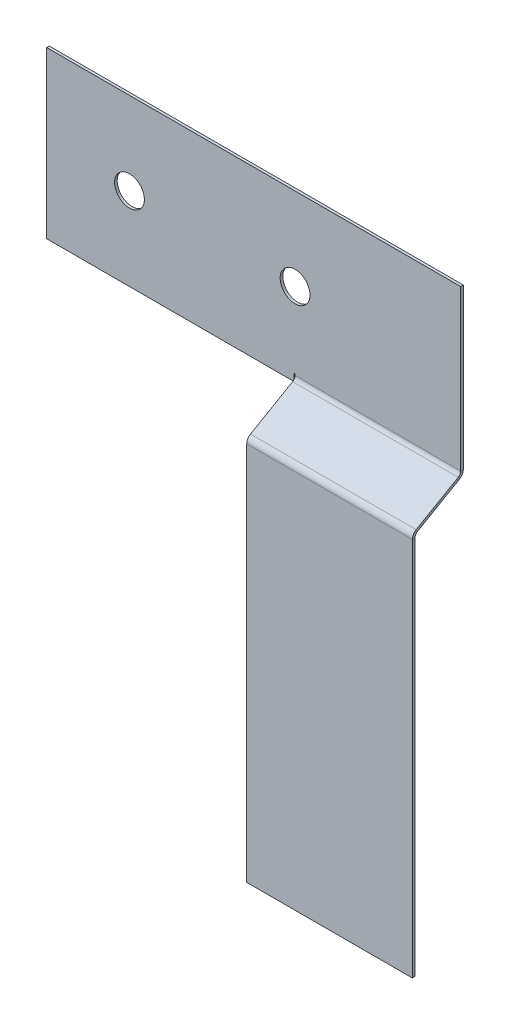
from build123d import *

# Parameters (mm, degrees)
SKETCH1_W            = 62.5
SKETCH1_H            = 25
SKETCH1_R            = 2.25
BASE_FLANGE1_DEPTH   = 0.4
EDGE_FLANGE1_START   = 37.3
EDGE_FLANGE1_DEPTH   = 25.2
EDGE_FLANGE1_2_DEPTH = 0.2
EDGE_FLANGE1_START_2 = 37.5
EDGE_FLANGE1_3_DEPTH = 25
EDGE_FLANGE2_DEPTH   = 25


# Read off the part's stored shape, not the designer's step: Edge-Flange1
# Sheet-metal steps are written as plain solids
with BuildPart() as part:
    # Sketch1 → Base-Flange1 (new body)
    with BuildSketch(Plane.XY):
        with Locations((31.25, 12.5)):
            Rectangle(SKETCH1_W, SKETCH1_H)
        with Locations((12.5, 12.5)):
            Circle(SKETCH1_R, mode=Mode.SUBTRACT)
        with Locations((37.5, 12.5)):
            Circle(SKETCH1_R, mode=Mode.SUBTRACT)
    extrude(amount=-BASE_FLANGE1_DEPTH)

    # Edge-Flange1 outline → Edge-Flange1 (cut)
    with BuildSketch(Plane.YZ.offset(EDGE_FLANGE1_START)):
        with BuildLine():
            Line((0, -0.4), (0.887156424, -0.4))
            ThreePointArc((0.887156424, -0.4), (0.410375552, -0.295165264), (0.021546812, 0))
            Line((0.021546812, 0), (0, 0))
            Line((0, 0), (0, -0.4))
        make_face()
    extrude(amount=EDGE_FLANGE1_DEPTH, mode=Mode.SUBTRACT)

    # Edge-Flange1 2 outline → Edge-Flange1 2 (cut)
    with BuildSketch(Plane.YZ.offset(EDGE_FLANGE1_START)):
        with BuildLine():
            Line((1.087156424, -0.4), (1.087156424, 0))
            Line((1.087156424, 0), (0.021546812, 0))
            ThreePointArc((0.021546812, 0), (0.410375552, -0.295165264), (0.887156424, -0.4))
            Line((0.887156424, -0.4), (1.087156424, -0.4))
        make_face()
    extrude(amount=EDGE_FLANGE1_2_DEPTH, mode=Mode.SUBTRACT)

    # Edge-Flange1 3 outline → Edge-Flange1 3 (add)
    with BuildSketch(Plane.YZ.offset(EDGE_FLANGE1_START_2)):
        with BuildLine():
            Line((0.021546812, 0), (0.887156424, 0))
            ThreePointArc((0.887156424, 0), (0.518856424, 0.098685688), (0.249242111, 0.3683))
            Line((0.249242111, 0.3683), (-3.422649731, 6.72820323))
            Line((-3.422649731, 6.72820323), (-3.769059892, 6.52820323))
            Line((-3.769059892, 6.52820323), (-0.09716805, 0.1683))
            ThreePointArc((-0.09716805, 0.1683), (-0.041630555, 0.081455507), (0.021546812, 0))
        make_face()
    extrude(amount=EDGE_FLANGE1_3_DEPTH)

    # Edge-Flange2 section (across the edge) → Edge-Flange2 (add)
    with BuildSketch(Plane(origin=(62.5, -3.981697996, 6.89650323), x_dir=(0, 0, -1), z_dir=(-1, 0, 0))):
        with BuildLine():
            Line((-0.4, 0.425276208), (-0.4, 57.769059892))
            Line((-0.4, 57.769059892), (0, 57.769059892))
            Line((0, 57.769059892), (0, 0.425276208))
            ThreePointArc((0, 0.425276208), (0.098685688, 0.056976208), (0.3683, -0.212638104))
            Line((0.3683, -0.212638104), (0.1683, -0.559048266))
            ThreePointArc((0.1683, -0.559048266), (-0.247724474, -0.143023792), (-0.4, 0.425276208))
        make_face()
    extrude(amount=EDGE_FLANGE2_DEPTH)


solid = part.part
